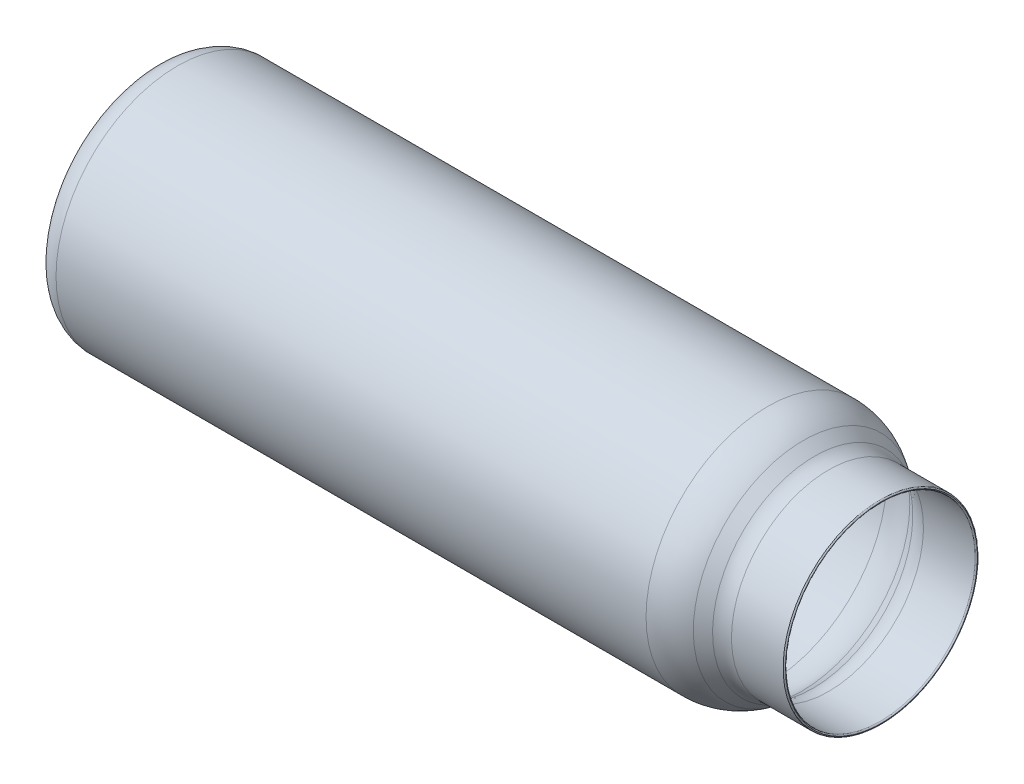
from build123d import *

# Parameters (mm, degrees)
FILLET5_R = 0.1


# Read off the part's stored shape, not the designer's step: Shell2
with BuildPart() as part:
    # Sketch1 → Revolve2 (revolve)
    with BuildSketch(Plane.XY, mode=Mode.PRIVATE) as revolve2_sk:
        with BuildLine():
            Line((-13.168856413, 10), (-61.724736666, 10))
            ThreePointArc((-61.724736666, 10), (-63.195959193, 9.354807837), (-63.717960476, 7.835504275))
            ThreePointArc((-63.717960476, 7.835504275), (-63.456676357, 3.920887953), (-63.318372348, 0))
            Line((-63.318372348, 0), (-3.789712276, 0))
            Line((-3.789712276, 0), (-3.789712276, 8))
            Line((-3.789712276, 8), (-8.140522989, 8))
            ThreePointArc((-8.140522989, 8), (-8.757997652, 8.097705322), (-9.315141754, 8.38127496))
            Line((-9.315141754, 8.38127496), (-10.2323095, 9.046812601))
            ThreePointArc((-10.2323095, 9.046812601), (-11.625169755, 9.755736694), (-13.168856413, 10))
        make_face()
    revolve(revolve2_sk.sketch.rotate(Axis((-65.592903297, 0, 0), (1, 0, 0)), 180), axis=Axis((-65.592903297, 0, 0), (1, 0, 0)))

    # Shell2 outline → Shell2 (revolve, cut)
    with BuildSketch(Plane.YX):
        with BuildLine():
            Line((0, -3.789712276), (0, -63.118334123))
            add(Edge.make_bspline(
                [(0, -63.118334123), (1.561706374, -63.148844093), (3.123319685, -63.203716495), (4.694496406, -63.283489256), (6.264037904, -63.387920963), (7.831172626, -63.516924162), (7.84156329, -63.517780589), (7.851953848, -63.518638095)],
                knots=[4.731922799, 4.731922799, 4.731922799, 4.731922799, 4.731922799, 4.731922799, 4.794313419, 4.794313419, 4.794729857, 4.794729857, 4.794729857, 4.794729857, 4.794729857, 4.794729857], degree=5, weights=[1, 1, 0.999999905, 0.999999905, 1, 1, 1, 1]))
            ThreePointArc((7.851953848, -63.518638095), (9.219327053, -63.048836941), (9.8, -61.724736666))
            Line((9.8, -61.724736666), (9.8, -13.168856413))
            ThreePointArc((9.8, -13.168856413), (9.565507226, -11.686917222), (8.884940097, -10.349771377))
            Line((8.884940097, -10.349771377), (8.219402456, -9.432603631))
            ThreePointArc((8.219402456, -9.432603631), (7.907475855, -8.819745119), (7.8, -8.140522989))
            Line((7.8, -8.140522989), (7.8, -3.789712276))
            Line((7.8, -3.789712276), (0, -3.789712276))
        make_face()
    revolve(axis=Axis((0, 0, 0), (1, 0, 0)), mode=Mode.SUBTRACT)

    # Fillet5
    fillet5_edges = [part.edges().sort_by_distance(p)[0] for p in [
        (-3.789712276, 8, 0),
        (-3.789712276, -7.8, 0),
    ]]
    fillet(fillet5_edges, radius=FILLET5_R - 0.0001)  # a hair under: the kernel refuses the full size


solid = part.part
